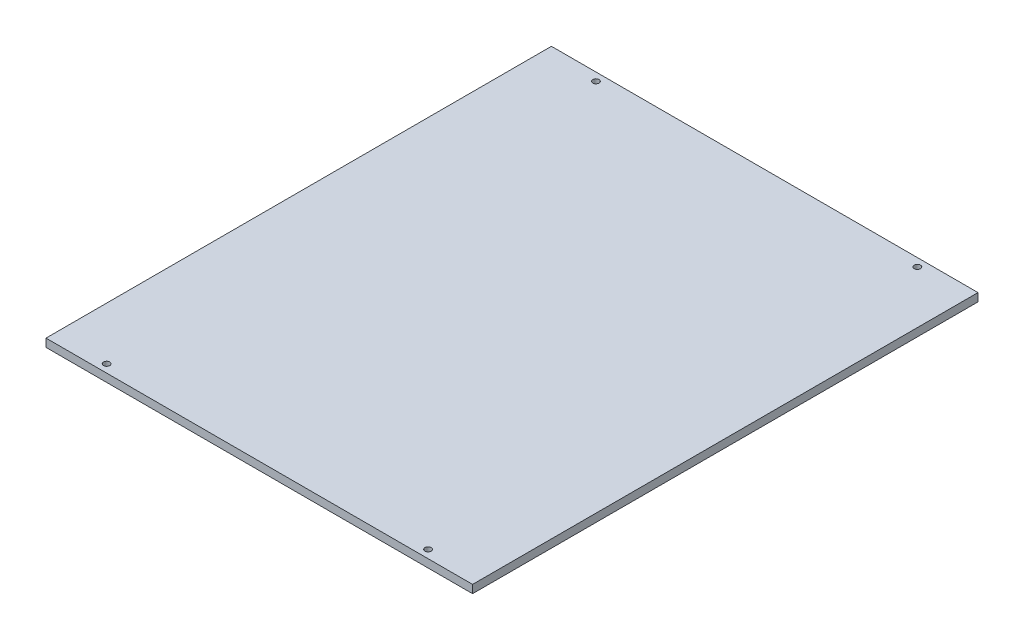
from build123d import *

# Parameters (mm, degrees)
SKETCH1_W           = 211
SKETCH1_H           = 250
SKETCH1_R           = 1.55
BOSS_EXTRUDE1_DEPTH = 4


with BuildPart() as part:
    # Sketch1 → Boss-Extrude1 (new body)
    with BuildSketch(Plane(origin=(0, 0, 0), x_dir=(1, 0, 0), z_dir=(0, 1, 0))):
        with Locations((-105.5, -125)):
            Rectangle(SKETCH1_W, SKETCH1_H)
        with Locations((-185, -4)):
            Circle(SKETCH1_R, mode=Mode.SUBTRACT)
        with Locations((-185, -246)):
            Circle(SKETCH1_R, mode=Mode.SUBTRACT)
        with Locations((-26, -246)):
            Circle(SKETCH1_R, mode=Mode.SUBTRACT)
        with Locations((-26, -4)):
            Circle(SKETCH1_R, mode=Mode.SUBTRACT)
    extrude(amount=BOSS_EXTRUDE1_DEPTH)


solid = part.part
